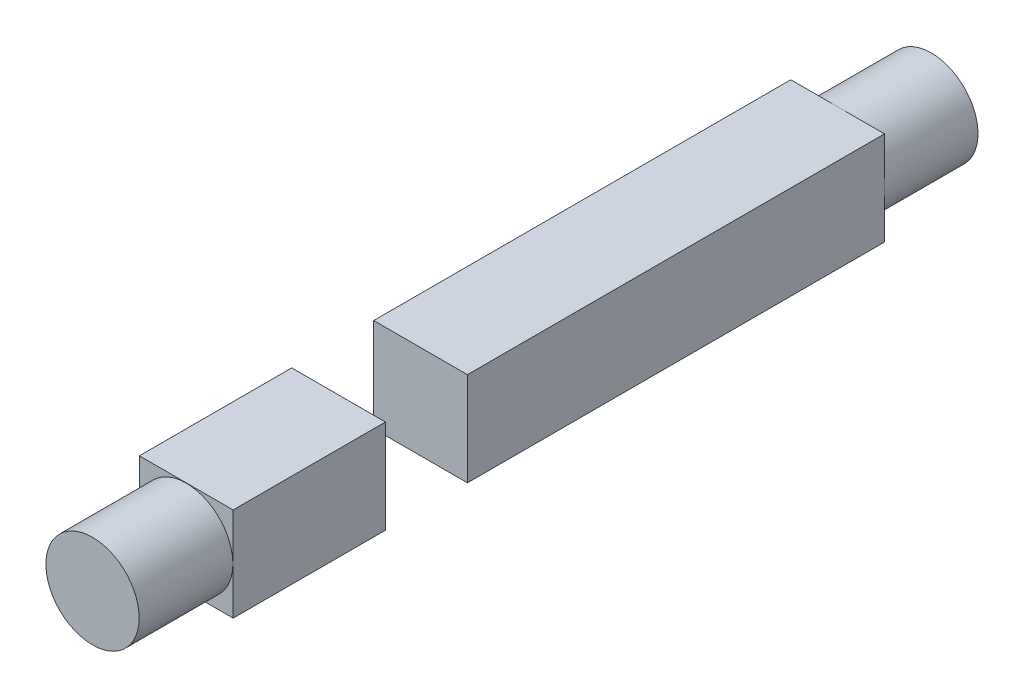
from build123d import *

# Parameters (mm, degrees)
SKETCH1_W           = 4
SKETCH1_H           = 4
BOSS_EXTRUDE1_DEPTH = 13.9
SKETCH2_R           = 1.99
BOSS_EXTRUDE2_DEPTH = 4
CUT_EXTRUDE1_REACH  = 20.45
SKETCH3_W           = 4
SKETCH3_H           = 3.5


with BuildPart() as part:
    # Sketch1 → Boss-Extrude1 (new, symmetric)
    with BuildSketch(Plane.XY):
        Rectangle(SKETCH1_W, SKETCH1_H)
    extrude(amount=BOSS_EXTRUDE1_DEPTH, both=True)

    # Sketch2 → Boss-Extrude2 (add)
    with BuildSketch(Plane.XY.offset(13.9)):
        Circle(SKETCH2_R)
    boss_extrude2 = extrude(amount=BOSS_EXTRUDE2_DEPTH)

    # Mirror2: Boss-Extrude2 across plane
    add(boss_extrude2.mirror(Plane.XY))

    # Sketch3 → Cut-Extrude1 (cut, up to next)
    with BuildSketch(Plane(origin=(0, 2, 0), x_dir=(1, 0, 0), z_dir=(0, 1, 0)), mode=Mode.PRIVATE) as cut_extrude1_sk1:
        with Locations((0, -5.65)):
            Rectangle(SKETCH3_W, SKETCH3_H)
    cut_extrude1_tool1 = extrude(cut_extrude1_sk1.sketch, amount=-CUT_EXTRUDE1_REACH, mode=Mode.PRIVATE) & part.part
    add(cut_extrude1_tool1.solids().sort_by_distance((0, 2, 5.65))[0], mode=Mode.SUBTRACT)


with BuildPart() as cut_extrude1_piece_1:
    # of the separate pieces the step leaves, piece 1, a body of its own (cut_extrude1_pieces)
    add(part.part.solids().sort_by_distance((2, -2, -13.9))[0])


with BuildPart() as cut_extrude1_piece_2:
    # of the separate pieces the step leaves, piece 2, a body of its own (cut_extrude1_pieces)
    add(part.part.solids().sort_by_distance((2, -2, 7.4))[0])


solid = Compound([cut_extrude1_piece_1.part, cut_extrude1_piece_2.part])
